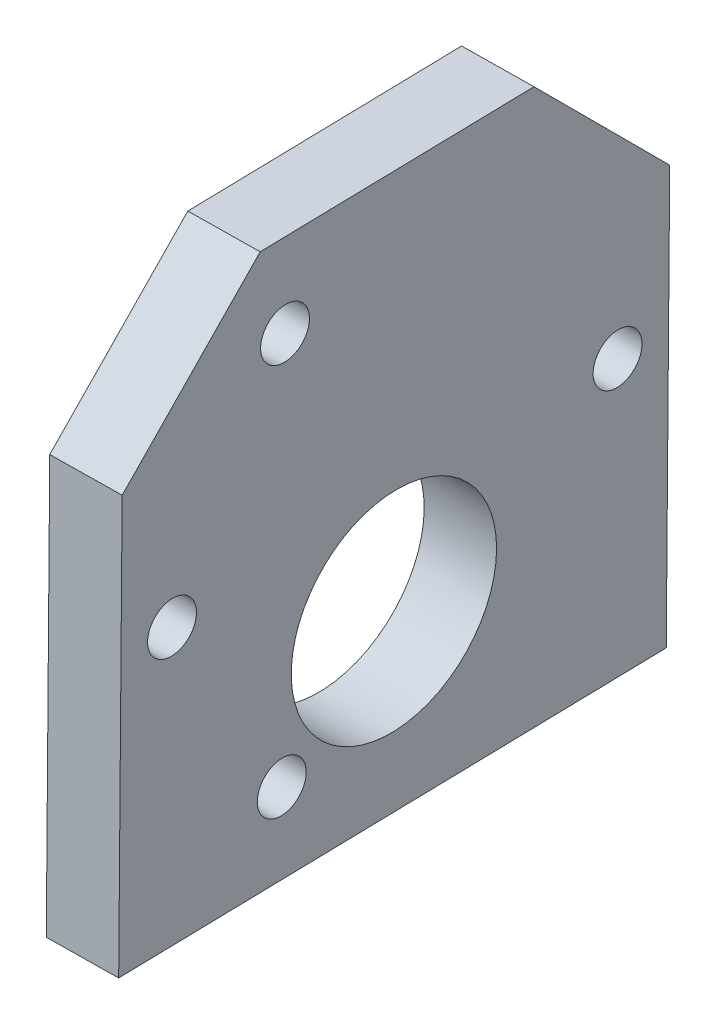
from build123d import *

# Parameters (mm, degrees)
SKETCH1_W            = 38.1
SKETCH1_H            = 38.1
SKETCH1_R            = 7.14375
BOSS_EXTRUDE1_DEPTH  = 4.826
CHAMFER1_SIZE        = 9.525
M3_CLEARANCE_HOLE1_D = 3.4


with BuildPart() as part:
    # Sketch1 → Boss-Extrude1 (new body)
    with BuildSketch(Plane(origin=(39.529642419, -0.323730785, -0.851619523), x_dir=(-0.021538100750096618, 8.818218568853461e-05, -0.9997680243136309), z_dir=(0.9997345031373621, -0.008187395970047001, -0.021538100750096614))):
        Rectangle(SKETCH1_W, SKETCH1_H)
        with Locations((0, -7.112)):
            Circle(SKETCH1_R, mode=Mode.SUBTRACT)
    extrude(amount=BOSS_EXTRUDE1_DEPTH)

    # Chamfer1
    chamfer1_edges = [part.edges().sort_by_distance(p)[0] for p in [
        (41.687670849, 18.707554321, -19.950851694),
        (42.508272488, 18.70419458, 18.140310032),
    ]]
    chamfer(chamfer1_edges, length=CHAMFER1_SIZE)

    # M3 Clearance Hole1 (through all)
    with Locations(Plane(origin=(44.354361132, -0.363243158, -0.955562398), x_dir=(-0.02153810075009662, 8.818218568853714e-05, -0.9997680243136309), z_dir=(0.9997345031373621, -0.008187395970047003, -0.021538100750096618))):
        with Locations((15.5, -0.112), (-15.5, -0.112), (-7.75, -13.535393759), (-7.75, 13.311393759)):
            Hole(M3_CLEARANCE_HOLE1_D / 2)


solid = part.part
